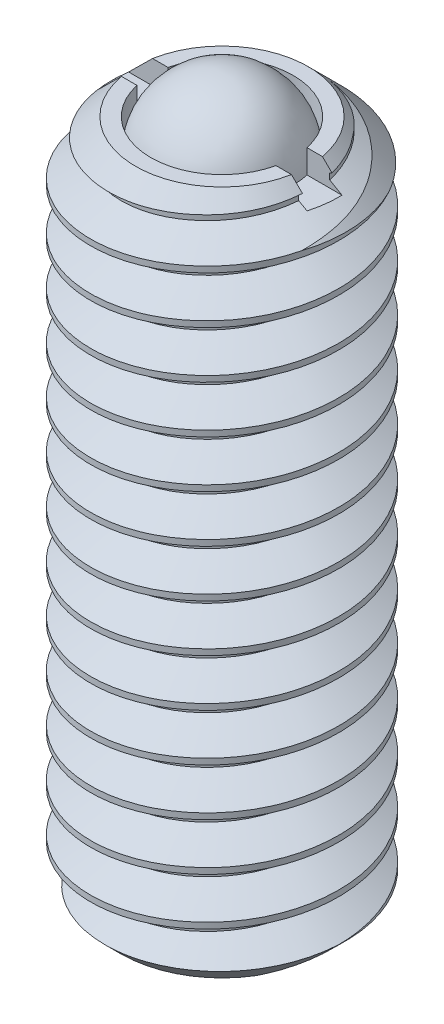
from build123d import *
from build123d.topology import SkipClean

# Parameters (mm, degrees)
SKETCH24_W               = 2.0828
SKETCH24_H               = 11.303
CUT_SWEEP1_PITCH         = 0.79375
SKETCH26_W               = 1.1938
SKETCH26_H               = 9.7028
CUT_EXTRUDE11_DEPTH      = 7.373034277
CUT_EXTRUDE11_DEPTH_BACK = 7.373034277
SKETCH28_W               = 0.5207
SKETCH28_H               = 0.396875
EXTRUDE12_DEPTH          = 0.8001


with BuildPart() as part:
    # Sketch24 → Revolve1 (revolve)
    with BuildSketch(Plane(origin=(0, 0, 0), x_dir=(0, 0, -1), z_dir=(1, 0, 0)), mode=Mode.PRIVATE) as revolve1_sk:
        with Locations((1.0414, 0)):
            Rectangle(SKETCH24_W, SKETCH24_H)
    revolve(revolve1_sk.sketch.rotate(Axis((0, 5.6515, 0), (0, -1, 0)), 180), axis=Axis((0, 5.6515, 0), (0, -1, 0)))

    # Cut-Sweep1: the profile of Sketch38 profile screwed along a right-hand helix of 15.24 turns, 8 arcs to a turn; built about Z, then put on its axis
    cut_sweep1_z = Axis((0, 0, 0), (0, 0, 1))
    cut_sweep1_corners = [(2.0831, 0, -0.694704455), (2.0831, 0, 0.000173205), (1.567244252, 0, -0.29765625), (1.567244252, 0, -0.396875)]
    with BuildLine(mode=Mode.PRIVATE) as cut_sweep1_profile:
        Line(cut_sweep1_corners[0], cut_sweep1_corners[1])
        Line(cut_sweep1_corners[1], cut_sweep1_corners[2])
        Line(cut_sweep1_corners[2], cut_sweep1_corners[3])
        Line(cut_sweep1_corners[3], cut_sweep1_corners[0])
    cut_sweep1_cap = Face(cut_sweep1_profile.wire())
    cut_sweep1_turn_angles = [0, 22.5, 45, 67.5, 90, 112.5, 135, 157.5, 180, 202.5, 225, 247.5, 270, 292.5, 315, 337.5, 360]
    cut_sweep1_turn_weights = [1, 0.9238795325112867, 1, 0.9238795325112867, 1, 0.9238795325112867, 1, 0.9238795325112867, 1, 0.9238795325112867, 1, 0.9238795325112867, 1, 0.9238795325112867, 1, 0.9238795325112867, 1]
    cut_sweep1_turn_rails = [Edge.make_bspline([Vector(p[0], p[1], 0).rotate(cut_sweep1_z, cut_sweep1_turn_angles[k]) / cut_sweep1_turn_weights[k] + Vector(0, 0, p[2] + CUT_SWEEP1_PITCH * cut_sweep1_turn_angles[k] / 360) for k in range(17)], [0, 0, 0, 1, 1, 2, 2, 3, 3, 4, 4, 5, 5, 6, 6, 7, 7, 8, 8, 8], 2, cut_sweep1_turn_weights) for p in cut_sweep1_corners]
    cut_sweep1_turn_sides = [Face.make_surface_from_curves(cut_sweep1_turn_rails[p[0]], cut_sweep1_turn_rails[p[1]]) for p in [(0, 1), (1, 2), (2, 3), (3, 0)]]
    cut_sweep1_last_angles = [5400, 5422.5, 5445, 5465.7, 5486.4]
    cut_sweep1_last_weights = [1, 0.9238795325112867, 1, 0.9354440308299442, 1]
    cut_sweep1_last_rails = [Edge.make_bspline([Vector(p[0], p[1], 0).rotate(cut_sweep1_z, cut_sweep1_last_angles[k]) / cut_sweep1_last_weights[k] + Vector(0, 0, p[2] + CUT_SWEEP1_PITCH * cut_sweep1_last_angles[k] / 360) for k in range(5)], [0, 0, 0, 1, 1, 2, 2, 2], 2, cut_sweep1_last_weights) for p in cut_sweep1_corners]
    cut_sweep1_last_sides = [Face.make_surface_from_curves(cut_sweep1_last_rails[p[0]], cut_sweep1_last_rails[p[1]]) for p in [(0, 1), (1, 2), (2, 3), (3, 0)]]
    cut_sweep1 = Plane(origin=(0, 5.6515, 0), x_dir=(0, 0, 1), z_dir=(0, -1, 0)) * Solid(Shell([*[p.moved(Location((0, 0, CUT_SWEEP1_PITCH * i))) for i in range(15) for p in cut_sweep1_turn_sides], *cut_sweep1_last_sides, cut_sweep1_cap, cut_sweep1_cap.rotate(cut_sweep1_z, 5486.4).moved(Location((0, 0, CUT_SWEEP1_PITCH * 5486.4 / 360)))]))
    add(cut_sweep1, mode=Mode.SUBTRACT)

    # Sketch26 → Cut-Revolve10 (revolve, cut)
    with BuildSketch(Plane(origin=(0, 0, 0), x_dir=(0, 0, -1), z_dir=(1, 0, 0))):
        with Locations((0.5969, 0.8001)):
            Rectangle(SKETCH26_W, SKETCH26_H)
    revolve(axis=Axis((0, -4.0513, 0), (0, 1, 0)), mode=Mode.SUBTRACT)

    # Sketch31 → Cut-Revolve13 (revolve, cut)
    with BuildSketch(Plane(origin=(0, 0, 0), x_dir=(0, 0, -1), z_dir=(1, 0, 0)), mode=Mode.PRIVATE) as cut_revolve13_sk:
        Polygon((2.0828, -5.6515), (1.7018, -5.6515), (2.0828, -5.2705), align=None)
        Polygon((2.0828, 5.6515), (1.4478, 5.6515), (2.0828, 5.0165), align=None)
    revolve(cut_revolve13_sk.sketch.rotate(Axis((0, 5.6515, 0), (0, -1, 0)), 9.39917973), axis=Axis((0, 5.6515, 0), (0, -1, 0)), mode=Mode.SUBTRACT)

    # Sketch28 → Cut-Extrude11 (cut, two sides: drawn at the far end of the back side and taken through both)
    with SkipClean():  # the faces are left unmerged after this step: merging them gives an invalid solid
        with BuildSketch(Plane(origin=(0, 0, 0), x_dir=(0, 0, -1), z_dir=(1, 0, 0)).offset(-CUT_EXTRUDE11_DEPTH_BACK)):
            with Locations((0, 5.4530625)):
                Rectangle(SKETCH28_W, SKETCH28_H)
        extrude(amount=CUT_EXTRUDE11_DEPTH + CUT_EXTRUDE11_DEPTH_BACK, mode=Mode.SUBTRACT)

    # Sketch46 → Extrude12 (cut)
    with SkipClean():  # the faces are left unmerged after this step: merging them gives an invalid solid
        with BuildSketch(Plane.XZ.offset(5.6515)):
            Polygon((-0.8001, 0.46193795), (-0.8001, -0.46193795), (0, -0.923875901), (0.8001, -0.46193795), (0.8001, 0.46193795), (0, 0.923875901), align=None)
        extrude(amount=-EXTRUDE12_DEPTH, mode=Mode.SUBTRACT)

    # Extrude13 cone 1 section (through the dimple's axis) → Extrude13 (revolve, cut)
    with SkipClean():  # the faces are left unmerged after this step: merging them gives an invalid solid
        with BuildSketch(Plane(origin=(0, -5.6515, 0), x_dir=(0, 0, -1), z_dir=(1, 0, 0))):
            Polygon((0, 0), (0.923875901, 0), (0, 0.5334), align=None)
        revolve(axis=Axis((0, -5.6515, 0), (0, 1, 0)), mode=Mode.SUBTRACT)


with BuildPart() as body_2:
    # Sketch27 → Revolve2 (revolve)
    with BuildSketch(Plane(origin=(0, 0, 0), x_dir=(0, 0, -1), z_dir=(1, 0, 0))):
        with BuildLine():
            Line((0, 6.2865), (0, 3.8989))
            ThreePointArc((0, 3.8989), (1.1938, 5.0927), (0, 6.2865))
        make_face()
    revolve(axis=Axis((0, 6.2865, 0), (0, -1, 0)))


solid = Compound([part.part, body_2.part])
